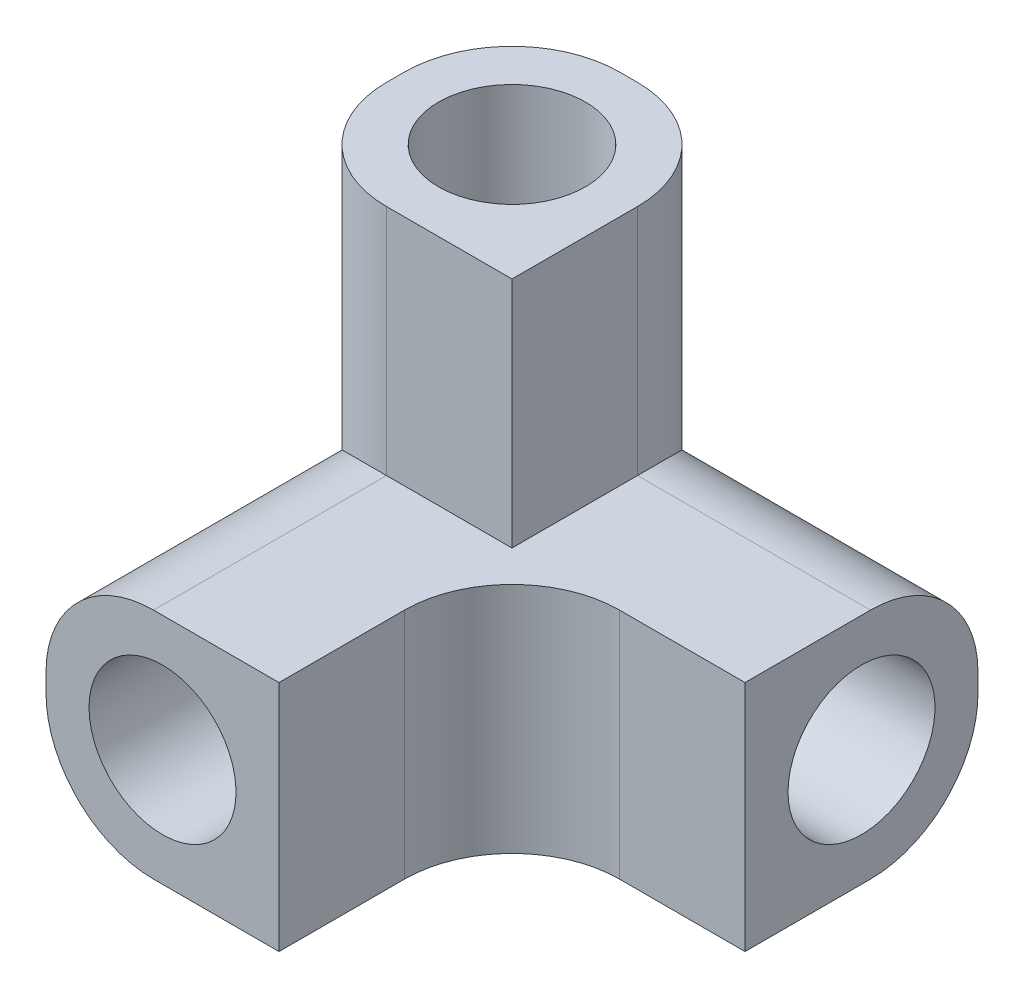
from build123d import *

# Parameters (mm, degrees)
SKETCH_1_W          = 6.5
SKETCH_1_H          = 6.5
SKETCH_1_R          = 2.05
EXTRUDE_1_DEPTH     = 6.5
SKETCH_2_W          = 6.5
SKETCH_2_H          = 13
EXTRUDE_2_DEPTH     = 6.5
SKETCH_3_W          = 6.5
SKETCH_3_H          = 6.5
SKETCH_3_R          = 2.05
EXTRUDE_3_DEPTH     = 6.5
SKETCH_4_R          = 2.05
CUT_EXTRUDE_1_DEPTH = 8
FILLET_1_R          = 3
FILLET_2_R          = 3


with BuildPart() as part:
    # 草图1 → 凸台-拉伸1 (new body)
    with BuildSketch(Plane.XY):
        with Locations((-8.580694703, 4.782128964)):
            Rectangle(SKETCH_1_W, SKETCH_1_H)
        with Locations(Location((-8.580694703, 4.782128964, 0), (0, 0, 180))):
            Circle(SKETCH_1_R, mode=Mode.SUBTRACT)
    extrude(amount=EXTRUDE_1_DEPTH)

    # 草图2 → 凸台-拉伸2 (add)
    with BuildSketch(Plane(origin=(-5.330694703, 0, 0), x_dir=(0, 0, -1), z_dir=(1, 0, 0))):
        with Locations((3.25, 8.032128964)):
            Rectangle(SKETCH_2_W, SKETCH_2_H)
    extrude(amount=-EXTRUDE_2_DEPTH)

    # 草图3 → 凸台-拉伸3 (add)
    with BuildSketch(Plane(origin=(-5.330694703, 0, 0), x_dir=(0, 0, -1), z_dir=(1, 0, 0))):
        with Locations((3.25, 4.782128964)):
            Rectangle(SKETCH_3_W, SKETCH_3_H)
        with Locations(Location((3.25, 4.782128964, 0), (0, 0, 180))):
            Circle(SKETCH_3_R, mode=Mode.SUBTRACT)
    extrude(amount=EXTRUDE_3_DEPTH)

    # 草图4 → 切除-拉伸1 (cut)
    with BuildSketch(Plane(origin=(0, 14.532128964, 0), x_dir=(1, 0, 0), z_dir=(0, 1, 0))):
        with Locations(Location((-8.580694703, 3.25, 0), (0, 0, 270))):
            Circle(SKETCH_4_R)
    extrude(amount=-CUT_EXTRUDE_1_DEPTH, mode=Mode.SUBTRACT)

    # 圆角1
    fillet_1_edges = [part.edges().sort_by_distance(p)[0] for p in [
        (-5.330694703, 1.532128964, -6.5),
        (-11.830694703, 11.282128964, 0),
        (-11.830694703, 8.032128964, -6.5),
        (-5.330694703, 11.282128964, -6.5),
        (-2.080694703, 8.032128964, -6.5),
        (-11.830694703, 1.532128964, 0),
        (-11.830694703, 8.032128964, 3.25),
    ]]
    fillet(fillet_1_edges, radius=FILLET_1_R)

    # 圆角2
    # the kernel refuses this fillet: 3 mm, written as the material it adds along each edge
    with BuildSketch(Plane(origin=(-5.330694703, 1.532128964, 0), x_dir=(0, 0, 1), z_dir=(0, 1, 0))) as fillet_2_piece_1:
        with BuildLine():
            CenterArc((FILLET_2_R, FILLET_2_R), FILLET_2_R, 180, 90)
            Line((0, FILLET_2_R), (0, 0))
            Line((0, 0), (FILLET_2_R, 0))
        make_face()
    extrude(amount=6.5)


solid = part.part
